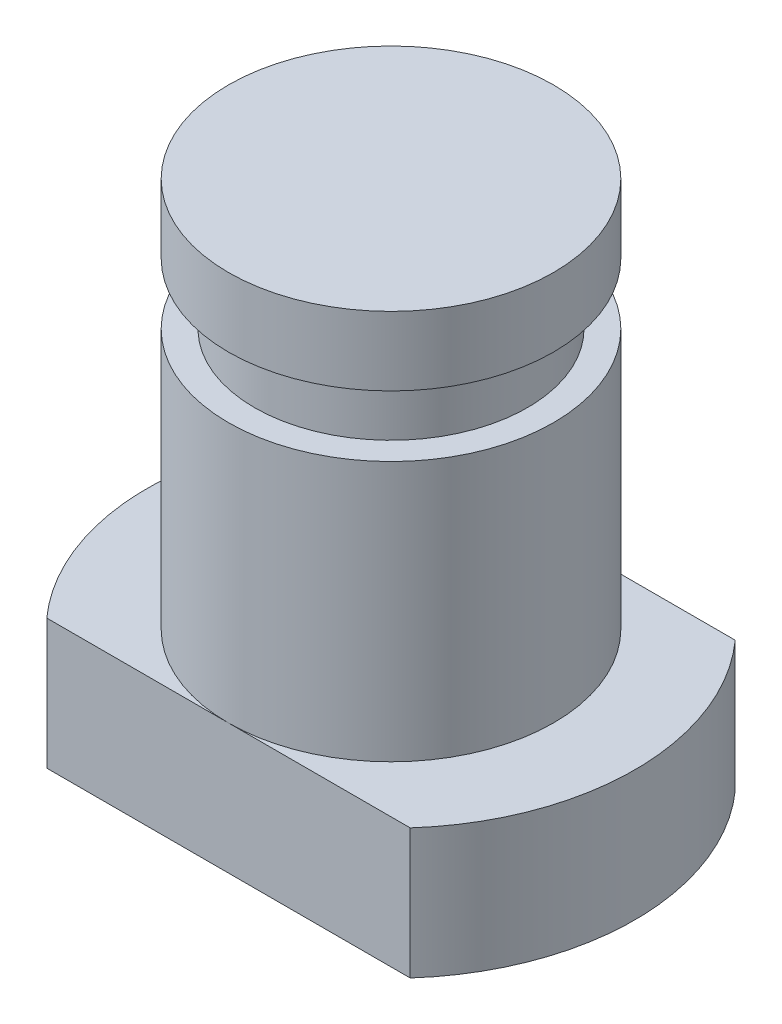
from build123d import *

# Parameters (mm, degrees)
SKETCH1_R           = 3.175
BOSS_EXTRUDE1_DEPTH = 7.62
BOSS_EXTRUDE2_DEPTH = 2.54
SKETCH6_OUTSIDE_W   = 14.587
SKETCH6_OUTSIDE_H   = 11.412
SKETCH6_OUTSIDE_R   = 2.667
CUT_EXTRUDE1_DEPTH  = 1.1938


with BuildPart() as part:
    # Sketch1 → Boss-Extrude1 (new body)
    with BuildSketch(Plane(origin=(0, 0, 0), x_dir=(1, 0, 0), z_dir=(0, 1, 0))):
        Circle(SKETCH1_R)
    extrude(amount=BOSS_EXTRUDE1_DEPTH)

    # Sketch2 → Boss-Extrude2 (add)
    with BuildSketch(Plane.XZ):
        with BuildLine():
            ThreePointArc((-3.549757914, 3.175), (-4.7625, 0), (-3.549757914, -3.175))
            Line((-3.549757914, -3.175), (3.549757914, -3.175))
            ThreePointArc((3.549757914, -3.175), (4.7625, 0), (3.549757914, 3.175))
            Line((3.549757914, 3.175), (-3.549757914, 3.175))
        make_face()
    extrude(amount=BOSS_EXTRUDE2_DEPTH)

    # Sketch6 outside → Cut-Extrude1 (cut)
    with BuildSketch(Plane(origin=(0, 5.08, 0), x_dir=(1, 0, 0), z_dir=(0, 1, 0))):
        with Locations((0.0005, 0)):
            Rectangle(SKETCH6_OUTSIDE_W, SKETCH6_OUTSIDE_H)
        Circle(SKETCH6_OUTSIDE_R, mode=Mode.SUBTRACT)
    extrude(amount=CUT_EXTRUDE1_DEPTH, mode=Mode.SUBTRACT)


solid = part.part
